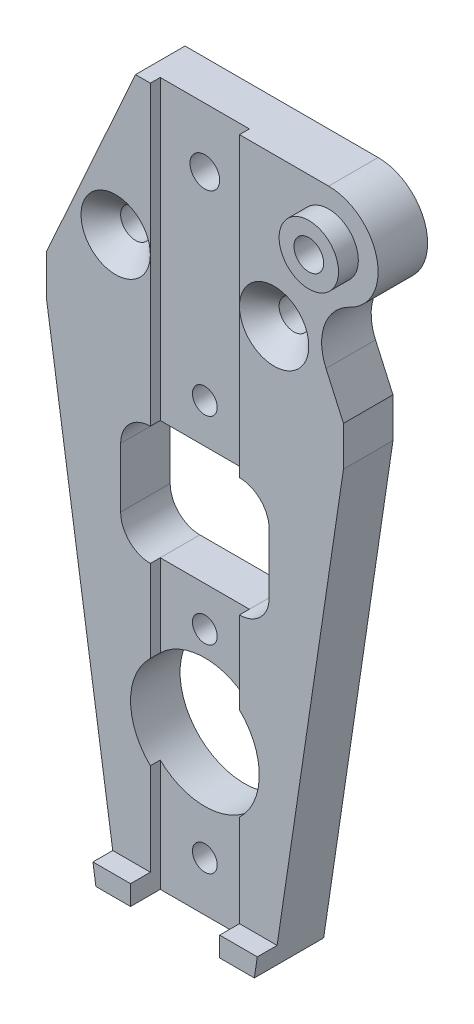
from build123d import *

# Parameters (mm, degrees)
SKETCH_1_R          = 6.5
SKETCH_1_R_2        = 1.5
SKETCH_1_W          = 15
SKETCH_1_H          = 12
EXTRUDE_1_DEPTH     = 5
HOLE_WIZARD_M3_1_D  = 2.5
SKETCH_2_W          = 9
SKETCH_2_H          = 83.78955867
CUT_EXTRUDE_1_DEPTH = 1
FILLET_1_R          = 3
EXTRUDE_2_DEPTH     = 2
CHAMFER_1_SIZE      = 2
SKETCH_5_R          = 1.5
EXTRUDE_4_DEPTH     = 5
FILLET_2_R          = 5
EXTRUDE_START       = 2
SKETCH_6_R          = 3
SKETCH_6_R_2        = 1.5
EXTRUDE_5_DEPTH     = 2


with BuildPart() as part:
    # 草图1 → 凸台-拉伸1 (new body)
    with BuildSketch(Plane.XY):
        Polygon((6, 55), (-6, 55), (-15, 35), (-15, 31), (-8, -16), (8, -16), (15, 31), (15, 35), align=None)
        Circle(SKETCH_1_R, mode=Mode.SUBTRACT)
        with Locations((0, 49)):
            Circle(SKETCH_1_R_2, mode=Mode.SUBTRACT)
        with Locations((-8, 40)):
            Circle(SKETCH_1_R_2, mode=Mode.SUBTRACT)
        with Locations(Location((8, 40, 0), (0, 0, 180))):
            Circle(SKETCH_1_R_2, mode=Mode.SUBTRACT)
        with Locations((0, 19)):
            Rectangle(SKETCH_1_W, SKETCH_1_H, mode=Mode.SUBTRACT)
    extrude(amount=EXTRUDE_1_DEPTH)

    # M3 螺纹孔1 (through all)
    with Locations(Plane.XY.offset(5)):
        with Locations((0, 29), (0, 9), (0, -11)):
            Hole(HOLE_WIZARD_M3_1_D / 2)

    # 草图2 → 切除-拉伸1 (cut)
    with BuildSketch(Plane.XY.offset(5)):
        with Locations((0, 22.915271632)):
            Rectangle(SKETCH_2_W, SKETCH_2_H)
    extrude(amount=-CUT_EXTRUDE_1_DEPTH, mode=Mode.SUBTRACT)

    # 圆角1
    fillet_1_edges = [part.edges().sort_by_distance(p)[0] for p in [
        (7.5, 13, 2.5),
        (-7.5, 13, 2.5),
        (-7.5, 25, 2.5),
        (7.5, 25, 2.5),
    ]]
    fillet(fillet_1_edges, radius=FILLET_1_R)

    # 草图4 → 凸台-拉伸2 (add)
    with BuildSketch(Plane.XY.offset(5)):
        Polygon((-8, -16), (-4.5, -16), (-4.5, -14), (-8.29787234, -14), align=None)
        Polygon((4.5, -14), (8.29787234, -14), (8, -16), (4.5, -16), align=None)
    extrude(amount=EXTRUDE_2_DEPTH)

    # 倒角1
    chamfer_1_edges = [part.edges().sort_by_distance(p)[0] for p in [
        (-9.5, 40, 5),
        (9.5, 40, 5),
    ]]
    chamfer(chamfer_1_edges, length=CHAMFER_1_SIZE - 0.0001)  # a hair under: the kernel refuses the full size

    # 草图5 → 凸台-拉伸4 (add)
    with BuildSketch(Plane.XY.offset(5)):
        with BuildLine():
            Line((6, 55), (13.5, 55))
            ThreePointArc((13.5, 55), (18.049597051, 47.926074574), (9.725789999, 46.720466669))
            Line((9.725789999, 46.720466669), (6, 55))
        make_face()
        with Locations((13.5, 50)):
            Circle(SKETCH_5_R, mode=Mode.SUBTRACT)
    extrude(amount=-EXTRUDE_4_DEPTH)

    # 圆角2
    fillet_2_edges = [part.edges().sort_by_distance(p)[0] for p in [
        (9.725789999, 46.720466669, 2.5),
    ]]
    fillet(fillet_2_edges, radius=FILLET_2_R)

    # 草图6 → 凸台-拉伸5 (add)
    with BuildSketch(Plane.XY.offset(5).offset(EXTRUDE_START)):
        with Locations((13.5, 50)):
            Circle(SKETCH_6_R)
        with Locations((13.5, 50)):
            Circle(SKETCH_6_R_2, mode=Mode.SUBTRACT)
    extrude(amount=-EXTRUDE_5_DEPTH)


solid = part.part
